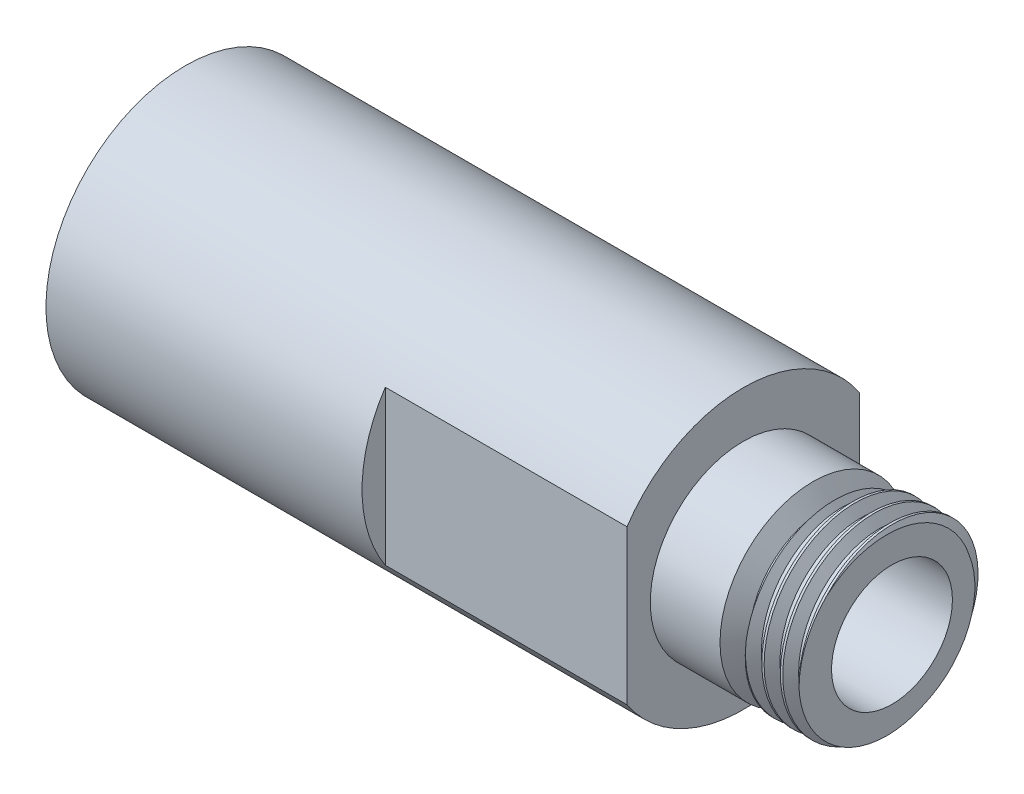
from build123d import *

# Parameters (mm, degrees)
SKETCH1_W                            = 40
SKETCH1_H                            = 7.5
F_6_5_6_5_DIAMETER_HOLE1_D           = 6.5
F_6_5_6_5_DIAMETER_HOLE1_CSINK_D     = 6.55
F_6_5_6_5_DIAMETER_HOLE1_CSINK_ANGLE = 90
SKETCH7_R                            = 7.5
SKETCH7_R_2                          = 5
CUT_EXTRUDE2_DEPTH                   = 10
CUT_EXTRUDE1_DEPTH                   = 13
THREAD1_PITCH                        = 1
SKETCH9_R                            = 5.340730363
CUT_EXTRUDE3_DEPTH                   = 2


with BuildPart() as part:
    # Sketch1 → Revolve1 (revolve)
    with BuildSketch(Plane.XY):
        with Locations((20, 3.75)):
            Rectangle(SKETCH1_W, SKETCH1_H)
    revolve(axis=Axis((40, 0, 0), (-1, 0, 0)))

    # Ø6.5 (6.5) Diameter Hole1 (through all)
    with Locations(Plane(origin=(40, 0, 0), x_dir=(0, 0, -1), z_dir=(1, 0, 0))):
        with Locations((0, 0)):
            CounterSinkHole(F_6_5_6_5_DIAMETER_HOLE1_D / 2, F_6_5_6_5_DIAMETER_HOLE1_CSINK_D / 2, counter_sink_angle=F_6_5_6_5_DIAMETER_HOLE1_CSINK_ANGLE)

    # Sketch7 → Cut-Extrude2 (cut)
    with BuildSketch(Plane(origin=(40, 0, 0), x_dir=(0, 0, -1), z_dir=(1, 0, 0))):
        with Locations(Location((0, 0, 0), (0, 0, 90))):
            Circle(SKETCH7_R)
        with Locations(Location((0, 0, 0), (0, 0, 90))):
            Circle(SKETCH7_R_2, mode=Mode.SUBTRACT)
    extrude(amount=-CUT_EXTRUDE2_DEPTH, mode=Mode.SUBTRACT)

    # Sketch6 → Cut-Extrude1 (cut)
    with BuildSketch(Plane(origin=(30, 0, 0), x_dir=(0, 0, -1), z_dir=(1, 0, 0))):
        with BuildLine():
            Line((-6.25, -4.145780988), (-6.25, 4.145780988))
            ThreePointArc((-6.25, 4.145780988), (-7.5, 0), (-6.25, -4.145780988))
        make_face()
        with BuildLine():
            ThreePointArc((7.5, 0), (7.180703308, 2.165063509), (6.25, 4.145780988))
            Line((6.25, 4.145780988), (6.25, -4.145780988))
            ThreePointArc((6.25, -4.145780988), (7.180703308, -2.165063509), (7.5, 0))
        make_face()
    extrude(amount=-CUT_EXTRUDE1_DEPTH, mode=Mode.SUBTRACT)

    # Thread1: the profile of Thread Profile1 profile screwed along a right-hand helix of 8 turns, 8 arcs to a turn; built about Z, then put on its axis
    thread1_z = Axis((0, 0, 0), (0, 0, 1))
    thread1_corners = [(5.0003, 0, -0.000173205), (5.0003, 0, 0.875173202), (4.458734125, 0, 0.562499999), (4.458734125, 0, 0.312499999)]
    with BuildLine(mode=Mode.PRIVATE) as thread1_profile:
        Line(thread1_corners[0], thread1_corners[1])
        Line(thread1_corners[1], thread1_corners[2])
        Line(thread1_corners[2], thread1_corners[3])
        Line(thread1_corners[3], thread1_corners[0])
    thread1_cap = Face(thread1_profile.wire())
    thread1_turn_angles = [0, 22.5, 45, 67.5, 90, 112.5, 135, 157.5, 180, 202.5, 225, 247.5, 270, 292.5, 315, 337.5, 360]
    thread1_turn_weights = [1, 0.9238795325112867, 1, 0.9238795325112867, 1, 0.9238795325112867, 1, 0.9238795325112867, 1, 0.9238795325112867, 1, 0.9238795325112867, 1, 0.9238795325112867, 1, 0.9238795325112867, 1]
    thread1_turn_rails = [Edge.make_bspline([Vector(p[0], p[1], 0).rotate(thread1_z, thread1_turn_angles[k]) / thread1_turn_weights[k] + Vector(0, 0, p[2] + THREAD1_PITCH * thread1_turn_angles[k] / 360) for k in range(17)], [0, 0, 0, 1, 1, 2, 2, 3, 3, 4, 4, 5, 5, 6, 6, 7, 7, 8, 8, 8], 2, thread1_turn_weights) for p in thread1_corners]
    thread1_turn_sides = [Face.make_surface_from_curves(thread1_turn_rails[p[0]], thread1_turn_rails[p[1]]) for p in [(0, 1), (1, 2), (2, 3), (3, 0)]]
    thread1 = Plane(origin=(43, 0, 0), x_dir=(0, 0, 1), z_dir=(-1, 0, 0)) * Solid(Shell([*[p.moved(Location((0, 0, THREAD1_PITCH * i))) for i in range(8) for p in thread1_turn_sides], thread1_cap, thread1_cap.rotate(thread1_z, 2880).moved(Location((0, 0, THREAD1_PITCH * 2880 / 360)))]))
    add(thread1, mode=Mode.SUBTRACT)

    # Sketch8 → Cut-Revolve1 (revolve, cut)
    with BuildSketch(Plane(origin=(0, 0, 0), x_dir=(1, 0, 0), z_dir=(0, 1, 0)), mode=Mode.PRIVATE) as cut_revolve1_sk:
        Polygon((35.104700538, 5), (33.75, 5), (34.327350269, 4), (34.527350269, 4), align=None)
    revolve(cut_revolve1_sk.sketch.rotate(Axis((0, 0, 0), (1, 0, 0)), 90), axis=Axis((0, 0, 0), (1, 0, 0)), mode=Mode.SUBTRACT)

    # Sketch9 → Cut-Extrude3 (cut)
    with BuildSketch(Plane(origin=(40, 0, 0), x_dir=(0, 0, -1), z_dir=(1, 0, 0))):
        Circle(SKETCH9_R)
    extrude(amount=-CUT_EXTRUDE3_DEPTH, mode=Mode.SUBTRACT)


solid = part.part
